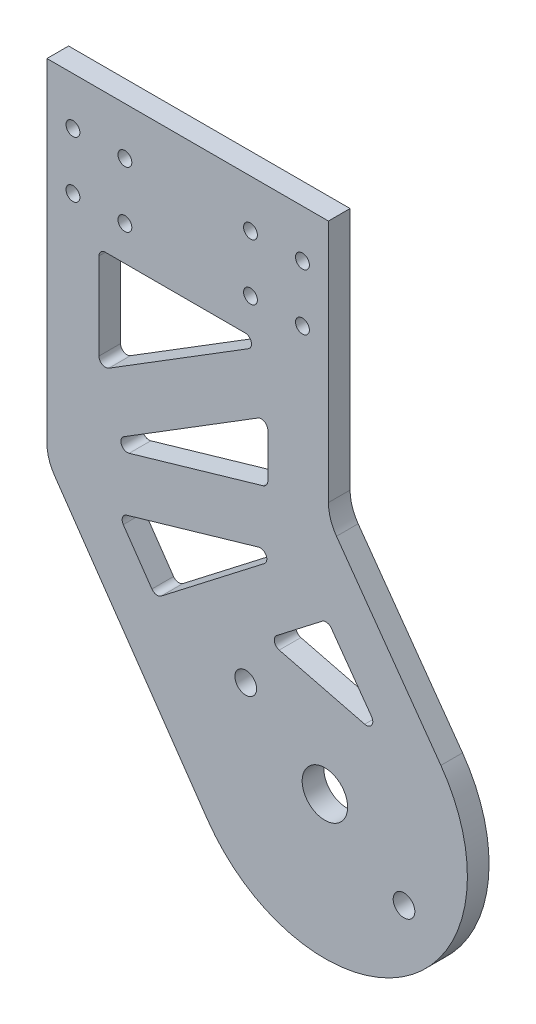
from build123d import *

# Parameters (mm, degrees)
SKETCH_1_W         = 80
SKETCH_1_H         = 130
SKETCH_1_R         = 5.25
EXTRUDE_1_DEPTH    = 5
SKETCH1_R          = 2.5
EXTRUDE1_DEPTH     = 5
CUT_EXTRUDE1_DEPTH = 10
EXTRUDE2_START     = -5
SKETCH3_R          = 2.760453652
SKETCH3_R_2        = 5.25
EXTRUDE2_DEPTH     = 5
SKETCH4_R          = 2.5
CUT_EXTRUDE2_DEPTH = 5
FILLET1_R          = 10
SKETCH5_R          = 1.6
CUT_EXTRUDE3_DEPTH = 10
CUT_EXTRUDE4_DEPTH = 18


with BuildPart() as part:
    # 草图1 → 凸台-拉伸1 (new body)
    with BuildSketch(Plane.XY):
        with Locations((0, 21)):
            Rectangle(SKETCH_1_W, SKETCH_1_H)
        with Locations((30, -29)):
            Circle(SKETCH_1_R, mode=Mode.SUBTRACT)
    extrude(amount=-EXTRUDE_1_DEPTH)

    # Sketch1 → Extrude1 (add)
    with BuildSketch(Plane.XY):
        Polygon((40, 21), (61.093174135, -36.95301964), (61.093174135, -54.95301964), (43.093174135, -54.95301964), (13, -44), (40, -44), align=None)
        with Locations((48.271023172, -42.130868678)):
            Circle(SKETCH1_R, mode=Mode.SUBTRACT)
    extrude(amount=-EXTRUDE1_DEPTH)

    # Sketch2 → Cut-Extrude1 (cut)
    with BuildSketch(Plane(origin=(0, 0, -5), x_dir=(-1, 0, 0), z_dir=(0, 0, -1))):
        with BuildLine():
            Line((-3.377558561, -47.641234182), (34.182437972, 6))
            Line((34.182437972, 6), (34.182437972, 86))
            Line((34.182437972, 86), (40, 86))
            Line((40, 86), (40, -82.83742168))
            Line((40, -82.83742168), (-89.511048432, -82.83742168))
            Line((-89.511048432, -82.83742168), (-89.511048432, 86.807911405))
            Line((-89.511048432, 86.807911405), (-30.817562028, 86))
            Line((-30.817562028, 86), (-30.817562028, 26.494421277))
            Line((-30.817562028, 26.494421277), (-56.622441439, -10.358765819))
            ThreePointArc((-56.622441439, -10.358765819), (-48.641234181, -55.62244144), (-3.377558561, -47.641234182))
        make_face()
    extrude(amount=-CUT_EXTRUDE1_DEPTH, mode=Mode.SUBTRACT)

    # Sketch3 → Extrude2 (add)
    with BuildSketch(Plane(origin=(0, 0, -5), x_dir=(-1, 0, 0), z_dir=(0, 0, -1)).offset(EXTRUDE2_START)):
        with BuildLine():
            Line((-30.817562028, 26.494421277), (-56.784941839, -9.8767641))
            ThreePointArc((-56.784941839, -9.8767641), (-48.915745177, -55.931874147), (-2.922800846, -47.707125558))
            Line((-2.922800846, -47.707125558), (34.182437972, 6))
            Line((34.182437972, 6), (-30.817562028, 26.494421277))
        make_face()
        with Locations((-48.271023167, -42.130868672)):
            Circle(SKETCH3_R, mode=Mode.SUBTRACT)
        with Locations((-30, -29)):
            Circle(SKETCH3_R_2, mode=Mode.SUBTRACT)
    extrude(amount=EXTRUDE2_DEPTH)

    # Sketch4 → Cut-Extrude2 (cut)
    with BuildSketch(Plane(origin=(0, 0, -5), x_dir=(-1, 0, 0), z_dir=(0, 0, -1))):
        with Locations((-11.728976828, -15.869131322)):
            Circle(SKETCH4_R)
    extrude(amount=-CUT_EXTRUDE2_DEPTH, mode=Mode.SUBTRACT)

    # Fillet1
    fillet1_edges = [part.edges().sort_by_distance(p)[0] for p in [
        (30.817562028, 26.494421277, -2.5),
        (-34.182437972, 6, -2.5),
    ]]
    fillet(fillet1_edges, radius=FILLET1_R)

    # Sketch5 → Cut-Extrude3 (cut)
    with BuildSketch(Plane.XY):
        with Locations((24.817562028, 62)):
            Circle(SKETCH5_R)
        with Locations((12.817562028, 62)):
            Circle(SKETCH5_R)
        with Locations((24.817562028, 75)):
            Circle(SKETCH5_R)
        with Locations((12.817562028, 75)):
            Circle(SKETCH5_R)
        with Locations((-16.182437972, 62)):
            Circle(SKETCH5_R)
        with Locations((-16.182437972, 75)):
            Circle(SKETCH5_R)
        with Locations((-28.182437972, 62)):
            Circle(SKETCH5_R)
        with Locations((-28.182437972, 75)):
            Circle(SKETCH5_R)
    extrude(amount=-CUT_EXTRUDE3_DEPTH, mode=Mode.SUBTRACT)

    # Sketch6 → Cut-Extrude4 (cut)
    with BuildSketch(Plane(origin=(0, 0, -5), x_dir=(-1, 0, 0), z_dir=(0, 0, -1))):
        with BuildLine():
            Line((-11.5559934, 54), (20.682437972, 54))
            ThreePointArc((20.682437972, 54), (21.743098144, 53.560660171), (22.182437972, 52.5))
            Line((22.182437972, 52.5), (22.182437972, 32.492448375))
            ThreePointArc((22.182437972, 32.492448375), (21.411663924, 31.181635836), (19.891465291, 31.217943679))
            Line((19.891465291, 31.217943679), (-12.346966081, 51.225495304))
            ThreePointArc((-12.346966081, 51.225495304), (-12.99851845, 52.911243818), (-11.5559934, 54))
        make_face()
        with BuildLine():
            Line((-14.526589347, 38.455061737), (16.406321223, 19.257731755))
            ThreePointArc((16.406321223, 19.257731755), (16.985650312, 17.373085225), (15.197393478, 16.542632195))
            Line((15.197393478, 16.542632195), (-15.735517092, 25.517096106))
            ThreePointArc((-15.735517092, 25.517096106), (-16.516922815, 26.056839317), (-16.817562028, 26.95769097))
            Line((-16.817562028, 26.95769097), (-16.817562028, 37.180557042))
            ThreePointArc((-16.817562028, 37.180557042), (-16.04678798, 38.49136958), (-14.526589347, 38.455061737))
        make_face()
        with BuildLine():
            Line((-14.677159453, 12.715199898), (15.73920461, 3.890599933))
            ThreePointArc((15.73920461, 3.890599933), (16.734417901, 2.952951587), (16.555361199, 1.597380632))
            Line((16.555361199, 1.597380632), (9.944464228, -7.971410325))
            ThreePointArc((9.944464228, -7.971410325), (8.940717699, -8.600990973), (7.793235732, -8.305755433))
            Line((7.793235732, -8.305755433), (-16.01223136, 10.08763549))
            ThreePointArc((-16.01223136, 10.08763549), (-16.432393209, 11.95407961), (-14.677159453, 12.715199898))
        make_face()
        with BuildLine():
            Line((-31.483543732, 4.90969585), (-40.781449667, -8.113407091))
            ThreePointArc((-40.781449667, -8.113407091), (-40.800039051, -9.829943874), (-39.195401052, -10.439846311))
            Line((-39.195401052, -10.439846311), (-19.456364222, -5.484125602))
            ThreePointArc((-19.456364222, -5.484125602), (-18.353315433, -4.335996082), (-18.904504706, -2.842306552))
            Line((-18.904504706, -2.842306552), (-29.345635601, 5.225075679))
            ThreePointArc((-29.345635601, 5.225075679), (-30.481660304, 5.522046616), (-31.483543732, 4.90969585))
        make_face()
    extrude(amount=-CUT_EXTRUDE4_DEPTH, mode=Mode.SUBTRACT)


solid = part.part
